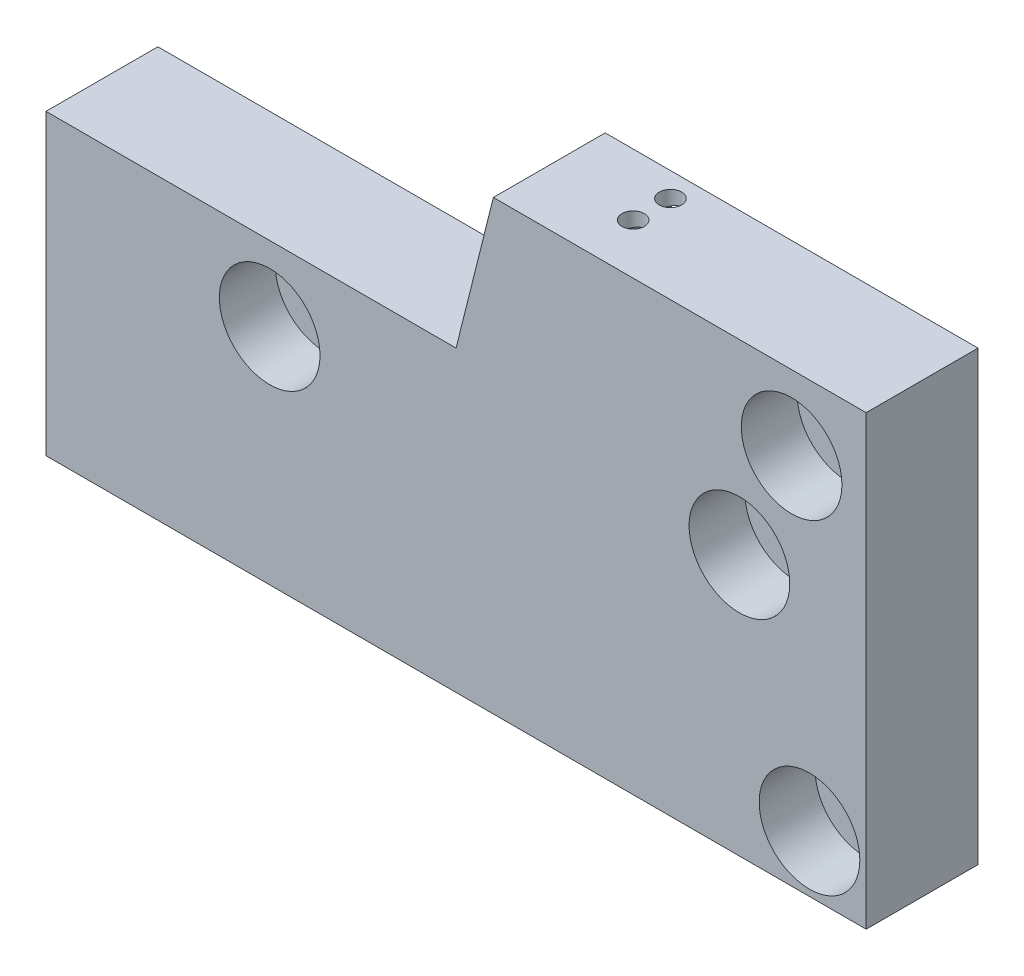
from build123d import *

# Parameters (mm, degrees)
BOSS_EXTRUDE1_DEPTH = 15
SKETCH1_4_R         = 3
CUT_EXTRUDE1_DEPTH  = 15
SKETCH1_5_R         = 3
CUT_EXTRUDE2_DEPTH  = 15
SKETCH2_R           = 3.25
CUT_EXTRUDE3_DEPTH  = 13
SKETCH3_R           = 6.75
CUT_EXTRUDE4_DEPTH  = 7.5
SKETCH5_R           = 1.5
CUT_EXTRUDE5_DEPTH  = 10
SKETCH6_R           = 1.5
CUT_EXTRUDE6_DEPTH  = 10


with BuildPart() as part:
    # Sketch1 → Boss-Extrude1 (new body)
    with BuildSketch(Plane.XY):
        Polygon((0, 0), (110, 0), (110, 60), (60, 60), (55, 40), (0, 40), align=None)
    extrude(amount=-BOSS_EXTRUDE1_DEPTH)

    # Sketch1<4> → Cut-Extrude1 (cut)
    with BuildSketch(Plane.XY):
        with Locations((93, 35)):
            Circle(SKETCH1_4_R)
        with Locations((30, 30)):
            Circle(SKETCH1_4_R)
    extrude(amount=-CUT_EXTRUDE1_DEPTH, mode=Mode.SUBTRACT)

    # Sketch1<5> → Cut-Extrude2 (cut)
    with BuildSketch(Plane.XY):
        with Locations((100, 50)):
            Circle(SKETCH1_5_R)
        with Locations((102.4, 7.6)):
            Circle(SKETCH1_5_R)
    extrude(amount=-CUT_EXTRUDE2_DEPTH, mode=Mode.SUBTRACT)

    # Sketch2 → Cut-Extrude3 (cut)
    with BuildSketch(Plane(origin=(0, 0, -15), x_dir=(-1, 0, 0), z_dir=(0, 0, -1))):
        with Locations((-72, 55)):
            Circle(SKETCH2_R)
        with Locations((-81, 5)):
            Circle(SKETCH2_R)
    extrude(amount=-CUT_EXTRUDE3_DEPTH, mode=Mode.SUBTRACT)

    # Sketch3 → Cut-Extrude4 (cut)
    with BuildSketch(Plane.XY):
        with Locations((100, 50)):
            Circle(SKETCH3_R)
        with Locations((93, 35)):
            Circle(SKETCH3_R)
        with Locations((102.4, 7.6)):
            Circle(SKETCH3_R)
        with Locations((30, 30)):
            Circle(SKETCH3_R)
    extrude(amount=-CUT_EXTRUDE4_DEPTH, mode=Mode.SUBTRACT)

    # Sketch5 → Cut-Extrude5 (cut)
    with BuildSketch(Plane(origin=(0, 60, 0), x_dir=(1, 0, 0), z_dir=(0, 1, 0))):
        with Locations((72, 11.75)):
            Circle(SKETCH5_R)
        with Locations((72, 6.75)):
            Circle(SKETCH5_R)
    extrude(amount=-CUT_EXTRUDE5_DEPTH, mode=Mode.SUBTRACT)

    # Sketch6 → Cut-Extrude6 (cut)
    with BuildSketch(Plane.XZ):
        with Locations((81, -6.75)):
            Circle(SKETCH6_R)
        with Locations((81, -11.75)):
            Circle(SKETCH6_R)
    extrude(amount=-CUT_EXTRUDE6_DEPTH, mode=Mode.SUBTRACT)


solid = part.part
